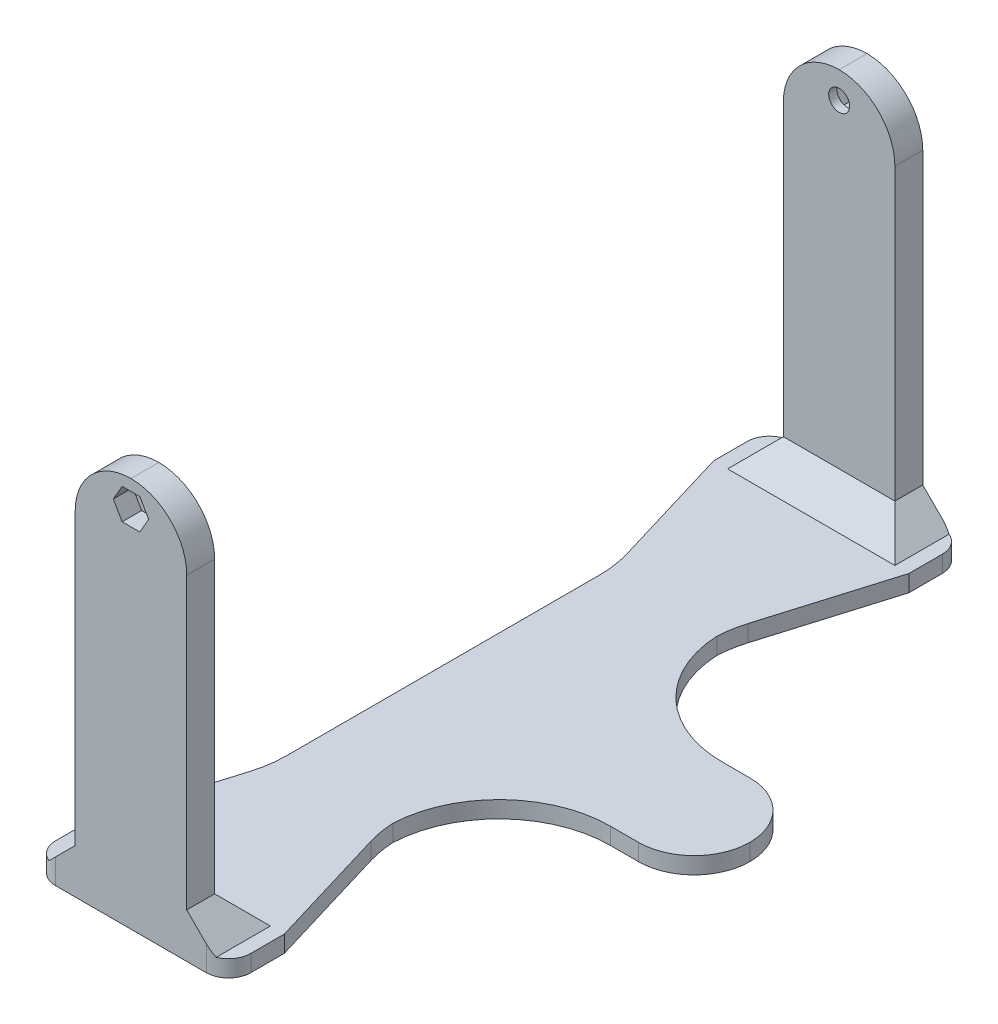
from build123d import *

# Parameters (mm, degrees)
SKETCH1_W           = 20
SKETCH1_H           = 132
BOSS_EXTRUDE1_DEPTH = 3
SKETCH2_W           = 20
SKETCH2_H           = 5
BOSS_EXTRUDE2_DEPTH = 67
SKETCH4_R           = 1.875
CUT_EXTRUDE1_DEPTH  = 150.746452379
FILLET3_R           = 10
CUT_EXTRUDE2_DEPTH  = 3.5
CUT_EXTRUDE3_DEPTH  = 3.5
SKETCH8_W           = 45
SKETCH8_H           = 20
BOSS_EXTRUDE3_DEPTH = 3
CHAMFER1_SIZE       = 5
FILLET4_R           = 10
FILLET5_R           = 4
FILLET6_R           = 20


# Some blends are built 0.0001 mm under size
with BuildPart() as part:
    # Sketch1 → Boss-Extrude1 (new body)
    with BuildSketch(Plane(origin=(0, 0, 0), x_dir=(1, 0, 0), z_dir=(0, 1, 0))):
        Rectangle(SKETCH1_W, SKETCH1_H)
    extrude(amount=BOSS_EXTRUDE1_DEPTH)

    # Sketch2 → Boss-Extrude2 (add)
    with BuildSketch(Plane(origin=(0, 3, 0), x_dir=(1, 0, 0), z_dir=(0, 1, 0))):
        with Locations((0, -63.5)):
            Rectangle(SKETCH2_W, SKETCH2_H)
        with Locations((0, 63.5)):
            Rectangle(SKETCH2_W, SKETCH2_H)
    extrude(amount=BOSS_EXTRUDE2_DEPTH)

    # Sketch4 → Cut-Extrude1 (cut, through all)
    with BuildSketch(Plane.XY.offset(66)):
        with Locations((0, 65.2375)):
            Circle(SKETCH4_R)
    extrude(amount=-CUT_EXTRUDE1_DEPTH, mode=Mode.SUBTRACT)

    # Fillet3
    fillet3_edges = [part.edges().sort_by_distance(p)[0] for p in [
        (10, 70, 63.5),
        (-10, 70, 63.5),
        (10, 70, -63.5),
        (-10, 70, -63.5),
    ]]
    fillet(fillet3_edges, radius=FILLET3_R - 0.0001)  # a hair under: the kernel refuses the full size

    # Sketch6 → Cut-Extrude2 (cut)
    with BuildSketch(Plane.XY.offset(66)):
        Polygon((3.175426481, 65.2375), (1.58771324, 67.9875), (-1.58771324, 67.9875), (-3.175426481, 65.2375), (-1.58771324, 62.4875), (1.58771324, 62.4875), align=None)
    extrude(amount=-CUT_EXTRUDE2_DEPTH, mode=Mode.SUBTRACT)

    # Sketch7 → Cut-Extrude3 (cut)
    with BuildSketch(Plane(origin=(0, 0, -66), x_dir=(-1, 0, 0), z_dir=(0, 0, -1))):
        Polygon((3.175426481, 65.2375), (1.58771324, 67.9875), (-1.58771324, 67.9875), (-3.175426481, 65.2375), (-1.58771324, 62.4875), (1.58771324, 62.4875), align=None)
    extrude(amount=-CUT_EXTRUDE3_DEPTH, mode=Mode.SUBTRACT)

    # Sketch8 → Boss-Extrude3 (add)
    with BuildSketch(Plane.XZ):
        Polygon((17.5, -56), (17.5, -66), (-17.5, -66), (-17.5, -56), (-10, -31), (10, -31), align=None)
        Polygon((17.5, 56), (17.5, 66), (-17.5, 66), (-17.5, 56), (-10, 31), (10, 31), align=None)
        with Locations((22.5, 0)):
            Rectangle(SKETCH8_W, SKETCH8_H)
    extrude(amount=-BOSS_EXTRUDE3_DEPTH)

    # Chamfer1
    chamfer1_edges = [part.edges().sort_by_distance(p)[0] for p in [
        (10, 3, -63.5),
        (-10, 3, -63.5),
        (10, 3, 63.5),
        (-10, 3, 63.5),
        (0, 3, 61),
        (0, 3, -61),
    ]]
    chamfer(chamfer1_edges, length=CHAMFER1_SIZE)

    # Fillet4
    fillet4_edges = [part.edges().sort_by_distance(p)[0] for p in [
        (45, 1.5, -10),
        (45, 1.5, 10),
    ]]
    fillet(fillet4_edges, radius=FILLET4_R - 0.0001)  # a hair under: the kernel refuses the full size

    # Fillet5
    fillet5_edges = [part.edges().sort_by_distance(p)[0] for p in [
        (17.5, 1.5, -66),
        (-17.5, 1.5, -66),
        (-17.5, 1.5, 66),
        (17.5, 1.5, 66),
    ]]
    fillet(fillet5_edges, radius=FILLET5_R)

    # Fillet6
    # the kernel refuses this fillet: 20 mm, written as the material it adds along each edge
    with BuildSketch(Plane(origin=(-10, 0, -31), x_dir=(-0.287347885566345, 0, -0.9578262852211515), z_dir=(0, 1, 0)), Plane(origin=(-10, 0, 31), x_dir=(0, 0, -1), z_dir=(0, 1, 0))) as fillet6_piece_1:
        with BuildLine():
            CenterArc((FILLET6_R * 0.146768836304, FILLET6_R), FILLET6_R, 253.300755766, 16.699244234)
            Line((-FILLET6_R * 0.140579049263, FILLET6_R * 0.0421737147788), (0, 0))
            Line((0, 0), (FILLET6_R * 0.146768836304, 0))
        make_face()
    extrude(amount=3)
    with BuildSketch(Plane(origin=(10, 0, 31), x_dir=(0, 0, -1), z_dir=(0, 1, 0)), Plane(origin=(10, 0, -31), x_dir=(0.287347885566345, 0, -0.9578262852211515), z_dir=(0, 1, 0))) as fillet6_piece_2:
        with BuildLine():
            CenterArc((FILLET6_R * 0.146768836304, -FILLET6_R), FILLET6_R, 90, 16.699244234)
            Line((-FILLET6_R * 0.140579049263, -FILLET6_R * 0.0421737147788), (0, 0))
            Line((0, 0), (FILLET6_R * 0.146768836304, 0))
        make_face()
    extrude(amount=3)
    with BuildSketch(Plane(origin=(10, 3, -10), x_dir=(0, 0, -1), z_dir=(0, -1, 0))) as fillet6_piece_3:
        with BuildLine():
            CenterArc((FILLET6_R, FILLET6_R), FILLET6_R, 180, 90)
            Line((0, FILLET6_R), (0, 0))
            Line((0, 0), (FILLET6_R, 0))
        make_face()
    extrude(amount=3)
    with BuildSketch(Plane(origin=(10, 0, 10), x_dir=(1, 0, 0), z_dir=(0, 1, 0))) as fillet6_piece_4:
        with BuildLine():
            CenterArc((FILLET6_R, -FILLET6_R), FILLET6_R, 90, 90)
            Line((0, -FILLET6_R), (0, 0))
            Line((0, 0), (FILLET6_R, 0))
        make_face()
    extrude(amount=3)


solid = part.part
